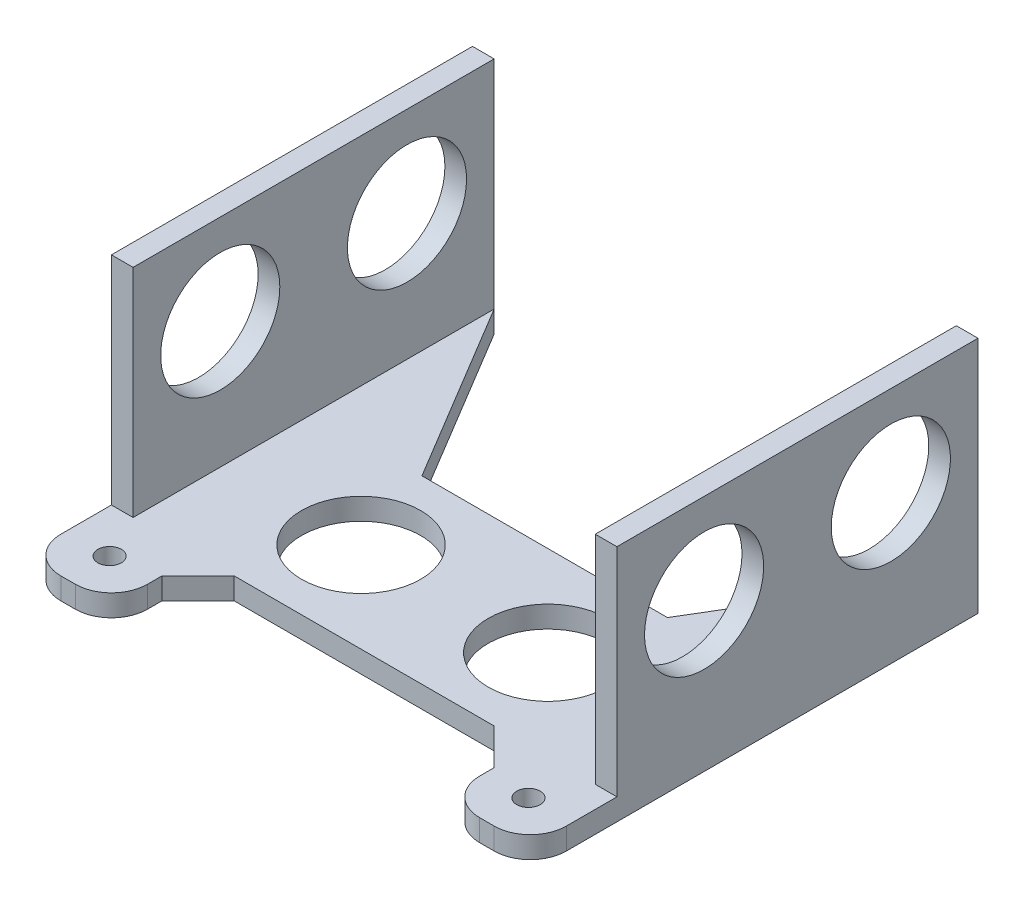
from build123d import *

# Parameters (mm, degrees)
CROQUIS1_W                 = 70
CROQUIS1_H                 = 62
SALIENTE_EXTRUIR1_DEPTH    = 3
CORTAR_EXTRUIR1_DEPTH      = 47.8508271
CORTAR_EXTRUIR2_DEPTH      = 47.8508271
CROQUIS4_W                 = 46
CROQUIS4_H                 = 10
CORTAR_EXTRUIR3_DEPTH      = 47.8508271
CROQUIS5_W                 = 46
CROQUIS5_H                 = 2
CORTAR_EXTRUIR4_DEPTH      = 47.8508271
CORTAR_EXTRUIR5_DEPTH      = 47.8508271
CORTAR_EXTRUIR5_DEPTH_BACK = 47.8508271
CROQUIS6_R                 = 1.625
CHAFL_N1_START             = -4
CHAFL_N1_OUTLINE_W         = 7.071067812
CHAFL_N1_OUTLINE_H         = 3
CHAFL_N1_DEPTH             = 4.707106781
CHAFL_N2_START             = -0.707106781
CHAFL_N2_OUTLINE_W         = 7.071067812
CHAFL_N2_OUTLINE_H         = 3
CHAFL_N2_DEPTH             = 4.707106781
CORTAR_EXTRUIR6_DEPTH      = 47.8508271
CORTAR_EXTRUIR6_DEPTH_BACK = 47.8508271
CROQUIS7_R                 = 8.25
SALIENTE_EXTRUIR2_DEPTH    = 3
CORTAR_EXTRUIR7_DEPTH      = 69.23672032
CORTAR_EXTRUIR7_DEPTH_BACK = 69.23672032
CORTAR_EXTRUIR8_DEPTH      = 47.8508271
CHAFL_N3_DEPTH             = 3
CHAFL_N5_DEPTH             = 3
CROQUIS13_W                = 50
CROQUIS13_H                = 30
SALIENTE_EXTRUIR3_DEPTH    = 3
CROQUIS14_W                = 50
CROQUIS14_H                = 30
SALIENTE_EXTRUIR4_DEPTH    = 3
REDONDEO1_R                = 5
CORTAR_EXTRUIR9_DEPTH      = 84.366660003
CORTAR_EXTRUIR9_DEPTH_BACK = 84.366660003
CROQUIS16_R                = 8.25


with BuildPart() as part:
    # Croquis1 → Saliente-Extruir1 (new body)
    with BuildSketch(Plane(origin=(0, 0, 0), x_dir=(1, 0, 0), z_dir=(0, 1, 0))):
        Rectangle(CROQUIS1_W, CROQUIS1_H)
    extrude(amount=SALIENTE_EXTRUIR1_DEPTH)

    # Croquis2 → Cortar-Extruir1 (cut, through all)
    with BuildSketch(Plane(origin=(0, 3, 0), x_dir=(1, 0, 0), z_dir=(0, 1, 0))):
        Polygon((31.754264805, 31), (15.877132403, 58.5), (-15.877132403, 58.5), (-31.754264805, 31), (-15.877132403, 3.5), (15.877132403, 3.5), align=None)
    extrude(amount=-CORTAR_EXTRUIR1_DEPTH, mode=Mode.SUBTRACT)

    # Croquis3 → Cortar-Extruir2 (cut, through all)
    with BuildSketch(Plane(origin=(0, 3, 0), x_dir=(1, 0, 0), z_dir=(0, 1, 0))):
        with BuildLine():
            Line((-13, -21), (13, -21))
            ThreePointArc((13, -21), (23, -31), (13, -41))
            Line((13, -41), (-13, -41))
            ThreePointArc((-13, -41), (-23, -31), (-13, -21))
        make_face()
    extrude(amount=-CORTAR_EXTRUIR2_DEPTH, mode=Mode.SUBTRACT)

    # Croquis4 → Cortar-Extruir3 (cut, through all)
    with BuildSketch(Plane(origin=(0, 3, 0), x_dir=(1, 0, 0), z_dir=(0, 1, 0))):
        with Locations((0, -26)):
            Rectangle(CROQUIS4_W, CROQUIS4_H)
    extrude(amount=-CORTAR_EXTRUIR3_DEPTH, mode=Mode.SUBTRACT)

    # Croquis5 → Cortar-Extruir4 (cut, through all)
    with BuildSketch(Plane(origin=(0, 3, 0), x_dir=(1, 0, 0), z_dir=(0, 1, 0))):
        with Locations((0, -20)):
            Rectangle(CROQUIS5_W, CROQUIS5_H)
    extrude(amount=-CORTAR_EXTRUIR4_DEPTH, mode=Mode.SUBTRACT)

    # Croquis6 → Cortar-Extruir5 (cut, two sides: drawn at the far end of the back side and taken through both)
    with BuildSketch(Plane(origin=(0, 3, 0), x_dir=(1, 0, 0), z_dir=(0, 1, 0)).offset(-CORTAR_EXTRUIR5_DEPTH_BACK)):
        with Locations(Location((-29, -25.25, 0), (0, 0, 270))):
            Circle(CROQUIS6_R)
        with Locations(Location((29, -25.25, 0), (0, 0, 270))):
            Circle(CROQUIS6_R)
    extrude(amount=CORTAR_EXTRUIR5_DEPTH + CORTAR_EXTRUIR5_DEPTH_BACK, mode=Mode.SUBTRACT)

    # Chaflán1: read off the stored shape, not the designer's step
    # Chaflán1 outline → Chaflán1 (add)
    with BuildSketch(Plane(origin=(0, 0, 0), x_dir=(0.7071067811865471, 0, -0.707106781186548), z_dir=(0.707106781186548, 0, 0.707106781186547)).offset(CHAFL_N1_START)):
        with Locations((-29.69848481, 1.5)):
            Rectangle(CHAFL_N1_OUTLINE_W, CHAFL_N1_OUTLINE_H)
    extrude(amount=CHAFL_N1_DEPTH)

    # Chaflán2: read off the stored shape, not the designer's step
    # Chaflán2 outline → Chaflán2 (add)
    with BuildSketch(Plane(origin=(0, 0, 0), x_dir=(0.707106781186548, 0, 0.707106781186547), z_dir=(0.707106781186547, 0, -0.707106781186548)).offset(CHAFL_N2_START)):
        with Locations((29.69848481, -1.5)):
            Rectangle(CHAFL_N2_OUTLINE_W, CHAFL_N2_OUTLINE_H)
    extrude(amount=CHAFL_N2_DEPTH)

    # Croquis7 → Cortar-Extruir6 (cut, two sides: drawn at the far end of the back side and taken through both)
    with BuildSketch(Plane(origin=(0, 3, 0), x_dir=(1, 0, 0), z_dir=(0, 1, 0)).offset(-CORTAR_EXTRUIR6_DEPTH_BACK)):
        with Locations(Location((-12.93, -6.5, 0), (0, 0, 270))):
            Circle(CROQUIS7_R)
        with Locations(Location((12.93, -6.5, 0), (0, 0, 270))):
            Circle(CROQUIS7_R)
    extrude(amount=CORTAR_EXTRUIR6_DEPTH + CORTAR_EXTRUIR6_DEPTH_BACK, mode=Mode.SUBTRACT)

    # Croquis8 → Saliente-Extruir2 (add)
    with BuildSketch(Plane(origin=(0, 3, 0), x_dir=(1, 0, 0), z_dir=(0, 1, 0))):
        Polygon((15.877132403, 3.5), (31.754264805, 31), (15.877132403, 58.5), (-15.877132403, 58.5), (-31.754264805, 31), (-15.877132403, 3.5), (0, 3.5), align=None)
    extrude(amount=-SALIENTE_EXTRUIR2_DEPTH)

    # Croquis9 → Cortar-Extruir7 (cut, two sides: drawn at the far end of the back side and taken through both)
    with BuildSketch(Plane(origin=(0, 3, 0), x_dir=(1, 0, 0), z_dir=(0, 1, 0)).offset(-CORTAR_EXTRUIR7_DEPTH_BACK)):
        Polygon((-232.018715641, 31), (-35, 31), (35, 31), (232.018715641, 31), (232.018715641, 425.037431282), (-232.018715641, 425.037431282), align=None)
    extrude(amount=CORTAR_EXTRUIR7_DEPTH + CORTAR_EXTRUIR7_DEPTH_BACK, mode=Mode.SUBTRACT)

    # Croquis10 → Cortar-Extruir8 (cut, through all)
    with BuildSketch(Plane(origin=(0, 3, 0), x_dir=(1, 0, 0), z_dir=(0, 1, 0))):
        Polygon((0, 6), (-32, 6), (-32, 31), (32, 31), (32, 6), align=None)
    extrude(amount=-CORTAR_EXTRUIR8_DEPTH, mode=Mode.SUBTRACT)

    # Chaflán3: read off the stored shape, not the designer's step
    # Chaflán3 outline → Chaflán3 (add)
    with BuildSketch(Plane(origin=(0, 0, 0), x_dir=(1, 0, 0), z_dir=(0, 1, 0))):
        Polygon((-32, 6), (-17, 6), (-32, 31), align=None)
    extrude(amount=CHAFL_N3_DEPTH)

    # Chaflán5: read off the stored shape, not the designer's step
    # Chaflán5 outline → Chaflán5 (add)
    with BuildSketch(Plane(origin=(0, 0, 0), x_dir=(1, 0, 0), z_dir=(0, 1, 0))):
        Polygon((32, 6), (32, 31), (17, 6), align=None)
    extrude(amount=CHAFL_N5_DEPTH)

    # Croquis13 → Saliente-Extruir3 (add)
    with BuildSketch(Plane.ZY.offset(35)):
        with Locations((-6, 18)):
            Rectangle(CROQUIS13_W, CROQUIS13_H)
    extrude(amount=-SALIENTE_EXTRUIR3_DEPTH)

    # Croquis14 → Saliente-Extruir4 (add)
    with BuildSketch(Plane(origin=(35, 0, 0), x_dir=(0, 0, -1), z_dir=(1, 0, 0))):
        with Locations((6, 18)):
            Rectangle(CROQUIS14_W, CROQUIS14_H)
    extrude(amount=-SALIENTE_EXTRUIR4_DEPTH)

    # Redondeo1
    redondeo1_edges = [part.edges().sort_by_distance(p)[0] for p in [
        (-23, 1.5, 31),
        (23, 1.5, 31),
        (35, 1.5, 31),
        (-35, 1.5, 31),
    ]]
    fillet(redondeo1_edges, radius=REDONDEO1_R)

    # Croquis16 → Cortar-Extruir9 (cut, two sides: drawn at the far end of the back side and taken through both)
    with BuildSketch(Plane.ZY.offset(35).offset(-CORTAR_EXTRUIR9_DEPTH_BACK)):
        with Locations((-18.93, 20.5)):
            Circle(CROQUIS16_R)
        with Locations((6.93, 20.5)):
            Circle(CROQUIS16_R)
    extrude(amount=CORTAR_EXTRUIR9_DEPTH + CORTAR_EXTRUIR9_DEPTH_BACK, mode=Mode.SUBTRACT)


solid = part.part
